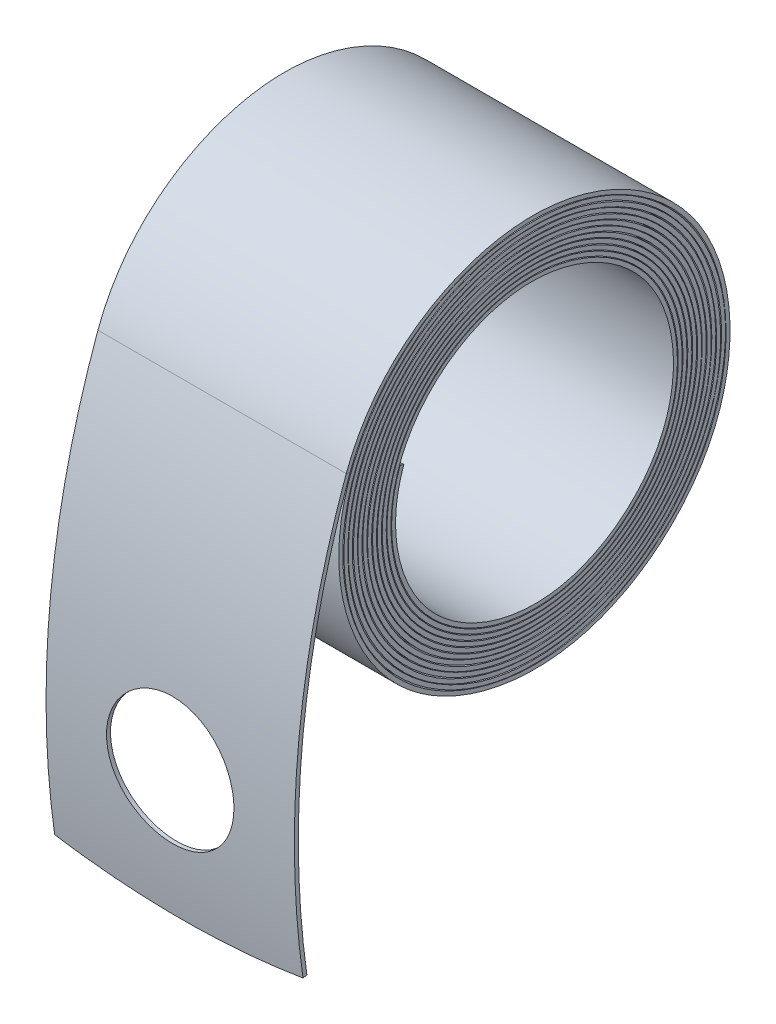
from build123d import *

# Parameters (mm, degrees)
SWEEP1_START            = -2.3749
SWEEP1_DEPTH            = 4.7498
CUT_EXTRUDE1_START      = -4.572
SKETCH7_R               = 1.2192000000000003
CUT_EXTRUDE1_DEPTH      = 0.12166700000000041
CUT_EXTRUDE2_REACH      = 13.155
CUT_EXTRUDE2_END_RADIUS = 16.369069678937333


# Read off the part's stored shape, not the designer's step: Sweep1
with BuildPart() as part:
    # Sweep1 outline → Sweep1 (new body)
    with BuildSketch(Plane.YZ.offset(SWEEP1_START)):
        with BuildLine():
            add(Edge.make_bspline(
                [(1.276898055, 3.508674079), (1.6207778462681415, 3.382007127660769), (1.9457669868007286, 3.204358095663798), (3.18678292573189, 2.265986014946895), (3.75422145730675, 1.07371677352094), (3.6735388158875, -1.29597878619303), (3.02808826352652, -2.44170412489401), (1.05174453831895, -3.73581445451106), (-0.2517671920637865, -3.8668589490294103), (-2.43956389479203, -2.9999255396709197), (-3.29428597823751, -2.01300511932185), (-3.8425929825748453, 0.266013062855288), (-3.52953148950345, 1.5284259136259801), (-1.98722297501447, 3.282250107974825), (-0.779828160464265, 3.75120041098481), (1.53351453670539, 3.50146302129273), (2.60777538466768, 2.78669163071244), (3.73162756099758, 0.759650464713165), (3.765625362695015, -0.5257261918965335), (2.75905914475021, -2.60321417708953), (1.73198544714417, -3.36858710705582), (-0.537781400891161, -3.74000341106201), (-1.74980518307769, -3.3426125811410747), (-3.3546080754273, -1.70727570723673), (-3.72571647682799, -0.4921160790770095), (-3.31479048123764, 1.75277138263188), (-2.53769220955819, 2.75228908871239), (-0.47388907515426504, 3.70462549932604), (0.7858520197412155, 3.64553236135599), (2.745192662344225, 2.51041948113967), (3.41931206548772, 1.45095287773703), (3.61910550041812, -0.795850651038309), (3.14252804355155, -1.95230600688994), (1.42778431871128, -3.40385785468192), (0.2122453784699265, -3.67905223502355), (-1.952808120007775, -3.11478615881886), (-2.87437900138071, -2.2831063024637), (-3.65625551913943, -0.195907189491174), (-3.50752223209037, 1.03110178911378), (-2.256525819320495, 2.86519684412496), (-1.17184312951588, 3.447382431003105), (1.03897574072216, 3.4809425730515153), (2.1354707056295847, 2.93130972054318), (3.4300899859580447, 1.1503079470838), (3.611828041107305, -0.05769922371598165), (2.903468983456325, -2.1334451439962), (2.0243068170648, -2.97385785089863), (-0.0721808703569389, -3.58787571454854), (-1.26058220867215, -3.35352293662327), (-2.96294452981682, -1.998962095872455), (-3.45373545807489, -0.896495094760027), (-3.32657578170129, 1.26603098814232), (-2.7107531910111, 2.29810631459482), (-0.8764944154524714, 3.43445120521951), (0.316564253599465, 3.52477557080314), (2.29392498037441, 2.68320937371314), (3.05126453264996, 1.76332950335773), (3.50027911378631, -0.328992953949677), (3.1854131383814703, -1.4734847666049902), (1.7392502822151301, -3.0382571406932097), (0.6270327069962415, -3.43860327848082), (-1.476493814298685, -3.157923641829615), (-2.43980939258598, -2.48214316040395), (-3.41785848302966, -0.608630866715912), (-3.41959425596945, 0.563138396342894), (-2.45548857325385, 2.43370276026913), (-1.50211823573805, 3.10717219819125), (0.573260556450094, 3.39429953419631), (1.668340686660315, 3.00471819515207), (3.091957716756105, 1.47917960640234), (3.40249959457761, 0.36467997621180603), (2.97712861054816, -1.6691970545567751), (2.24754211882144, -2.56073205261608), (0.3481883520790115, -3.3808406766345), (-0.7963030738472354, -3.29795173027572), (-2.55234735464725, -2.22174725485987), (-3.14143213103142, -1.24276640275922), (-3.27169985849562, 0.804148577151152), (-2.8126039959835403, 1.84455572397366), (-1.221121146804285, 3.12450696749818), (-0.110912973478176, 3.346845974177585), (1.8433608155878, 2.78552827908218), (2.66107791327875, 2.00892916028272), (3.32398883541352, 0.0965343916564848), (3.16106463446891, -1.01437131229279), (1.98385502022341, -2.65034623665456), (0.9865297544781, -3.154339840167355), (-1.02013853260629, -3.1343271589948296), (-2.0020185831695647, -2.61152769373797), (-3.134489760449465, -0.965448846023538), (-3.27287596466396, 0.1333631979129235), (-2.55814608752095, 2.06956192391548), (-1.63542024961609, 2.84561311761919), (0.458315043293819, 3.24370686883354), (1.5927750603682802, 2.8531304617058), (3.00181290549162, 1.26673037638302), (3.25211538015178, 0.09922608167140684), (2.61597968218324, -1.91315752641214), (1.747471961594155, -2.72416849437505), (-0.2937755766731675, -3.21361974851485), (-1.4293078777473749, -2.883918638470485), (-2.894490728905355, -1.3934802119036251), (-3.19395976490287, -0.25569819050230347), (-2.667977782223395, 1.75728679624163), (-1.85241520361399, 2.597241893572095), (0.134700019737362, 3.17464855979853), (1.26887483324066, 2.90826730683807), (2.77949410767114, 1.51082050892951), (3.12909126034985, 0.4056245409043665), (2.71205401144065, -1.600268910251645), (1.94772850450175, -2.46386615990184), (0.0206750154987051, -3.13120714035576), (-1.1079039321065451, -2.92381955861822), (-2.66029894360071, -1.6187663839698598), (-3.060637818133615, -0.5494726169589825), (-2.744236738838985, 1.44218343674698), (-2.03396814457547, 2.32864638325915), (-0.172589113260102, 3.08068199010451), (0.9470182796280875, 2.927970101070905), (2.539521960249445, 1.7211869810710398), (2.98474382057348, 0.6889105662532831), (2.7664306923024, -1.28590635283188), (2.1132270579199, -2.19388000230336), (0.3188195919299255, -3.01988356781702), (-0.7896696253832995, -2.9236895574773447), (-2.41490215361793, -1.816861087029025), (-2.8996276334866, -0.821966783054405), (-2.78322490365266, 1.13143000732143), (-2.18480569671214, 2.05550386375984), (-0.458016497437425, 2.95195782607403), (0.636587809871466, 2.91394237892685), (2.28505158776698, 1.90224824884599), (2.809597174177845, 0.947450350068445), (2.792399151971675, -0.977572916536472), (2.2460911830819352, -1.91316726671638), (0.5927183667195666, -2.88062935765657), (-0.4848100072623935, -2.8959742854326347), (-2.15331580883726, -1.977940011386), (-2.7174696126864752, -1.06638708194566), (-2.79032102406424, 0.825128061423298), (-2.29846622213315, 1.77103148504932), (-0.7226859646830226, 2.80344950957273), (0.335516564066088, 2.86745105165632), (2.02131884603029, 2.04805371786421), (2.61939421171567, 1.17973497986579), (2.77930170748669, -0.676550493083939), (2.34430745602026, -1.63083274610888), (0.8453043047062574, -2.71789607164799), (-0.191342216634435, -2.8317715386465654), (-1.88719575183536, -2.111069821480255), (-2.51412472644904, -1.28521732837661), (-2.76358009588812, 0.530885891715558), (-2.382340074041455, 1.48889435499151), (-0.9597926027607504, 2.62722304874707), (0.0443495350690404, 2.7948021468393103), (0.901359187, 2.477659233)],
                knots=[5.1701112334e-07, 5.1701112334e-07, 5.1701112334e-07, 5.1701112334e-07, 0.00390625000000151, 0.00390625000000151, 0.0166015625000064, 0.0166015625000064, 0.02929687500001129, 0.02929687500001129, 0.04199218750001619, 0.04199218750001619, 0.05468750000002108, 0.05468750000002108, 0.06738281250002608, 0.06738281250002608, 0.08007812500003096, 0.08007812500003096, 0.09277343750003586, 0.09277343750003586, 0.10546875000004066, 0.10546875000004066, 0.11816406250004555, 0.11816406250004555, 0.13085937500005043, 0.13085937500005043, 0.14355468750005534, 0.14355468750005534, 0.15625000000006023, 0.15625000000006023, 0.16894531250006511, 0.16894531250006511, 0.18164062500007003, 0.18164062500007003, 0.1943359375000749, 0.1943359375000749, 0.2070312500000798, 0.2070312500000798, 0.2197265625000847, 0.2197265625000847, 0.2324218750000896, 0.2324218750000896, 0.24511718750009448, 0.24511718750009448, 0.25781250000009936, 0.25781250000009936, 0.27050781250010425, 0.27050781250010425, 0.2832031250001092, 0.2832031250001092, 0.2958984375001141, 0.2958984375001141, 0.30859375000011896, 0.30859375000011896, 0.32128906250012385, 0.32128906250012385, 0.33398437500012873, 0.33398437500012873, 0.3466796875001336, 0.3466796875001336, 0.35937500000013856, 0.35937500000013856, 0.37207031250014344, 0.37207031250014344, 0.3847656250001483, 0.3847656250001483, 0.3974609375001532, 0.3974609375001532, 0.4101562500001581, 0.4101562500001581, 0.422851562500163, 0.422851562500163, 0.43554687500016787, 0.43554687500016787, 0.4482421875001728, 0.4482421875001728, 0.4609375000001777, 0.4609375000001777, 0.4736328125001826, 0.4736328125001826, 0.48632812500018746, 0.48632812500018746, 0.49902343750019235, 0.49902343750019235, 0.5117187500001973, 0.5117187500001973, 0.5244140625002022, 0.5244140625002022, 0.5371093750002071, 0.5371093750002071, 0.5498046875002119, 0.5498046875002119, 0.5625000000002168, 0.5625000000002168, 0.576171875000222, 0.576171875000222, 0.5898437500002274, 0.5898437500002274, 0.6035156250002326, 0.6035156250002326, 0.6171875000002379, 0.6171875000002379, 0.6308593750002431, 0.6308593750002431, 0.6445312500002485, 0.6445312500002485, 0.6582031250002537, 0.6582031250002537, 0.671875000000259, 0.671875000000259, 0.6855468750002642, 0.6855468750002642, 0.6992187500002696, 0.6992187500002696, 0.7128906250002748, 0.7128906250002748, 0.7265625000002801, 0.7265625000002801, 0.7402343750002853, 0.7402343750002853, 0.7539062500002907, 0.7539062500002907, 0.7675781250002959, 0.7675781250002959, 0.7812500000003011, 0.7812500000003011, 0.7949218750003064, 0.7949218750003064, 0.8085937500003116, 0.8085937500003116, 0.822265625000317, 0.822265625000317, 0.8359375000003222, 0.8359375000003222, 0.8496093750003275, 0.8496093750003275, 0.8632812500003327, 0.8632812500003327, 0.8769531250003381, 0.8769531250003381, 0.8906250000003433, 0.8906250000003433, 0.9042968750003486, 0.9042968750003486, 0.9179687500003538, 0.9179687500003538, 0.9316406250003592, 0.9316406250003592, 0.9453125000003644, 0.9453125000003644, 0.9589843750003697, 0.9589843750003697, 0.9726562500003749, 0.9726562500003749, 0.9863281250003803, 0.9863281250003803, 1.0000000000003855, 1.0000000000003855, 1.0000000000003855, 1.0000000000003855], degree=3))
            Line((0.901359187, 2.477659233), (0.927804883, 2.549122966))
            add(Edge.make_bspline(
                [(1.303096746, 3.580228885), (1.65409620240162, 3.45095508558113), (1.98567666238742, 3.26971219876617), (3.25227316447132, 2.31199783279412), (3.83120392654069, 1.0954015049437), (3.74886808893214, -1.32284937955597), (3.09009853662135, -2.49218232114899), (1.07322026296345, -3.81283468248739), (-0.25725532369999, -3.94664868886222), (-2.49021844243242, -3.06181769551869), (-3.36264408243786, -2.05463718043056), (-3.92240687103053, 0.271996553272543), (-3.60279456261327, 1.5605047358059), (-2.02840283449015, 3.35081210843279), (-0.795735213028206, 3.82956040375486), (1.56577892208427, 3.57462265650263), (2.66263921889309, 2.84488512134441), (3.8100489411455, 0.775354278696821), (3.84487733887617, -0.536914730813621), (2.81695699220992, -2.65847626552298), (1.76826378790952, -3.43986411104766), (-0.549448889784547, -3.81912609447056), (-1.7872241092326, -3.413274786733), (-3.42596291575984, -1.743356312757), (-3.80504496497029, -0.502290268785167), (-3.38537116829808, 1.79038640304962), (-2.59185333089602, 2.8112181332651), (-0.483582021617319, 3.78407426377925), (0.803030872761775, 3.72364392858732), (2.80440993100094, 2.56417676008768), (3.49306680582596, 1.48183267991052), (3.6971517682563, -0.81323178969941), (3.21030161922877, -1.99477088816058), (1.45847664444308, -3.47771247418269), (0.216723335257802, -3.75896473405012), (-1.99572134108026, -3.18234735391898), (-2.93721498494998, -2.33258528530911), (-3.7361345980728, -0.199890070949856), (-3.58412391538761, 1.05402572025375), (-2.30582593885551, 2.92814779897379), (-1.19728856081001, 3.52320494934774), (1.06210801248201, 3.5575024988826), (2.18270929393094, 2.99592067651396), (3.50612433016174, 1.17530471461723), (3.69178994757959, -0.0593193367794181), (2.96773997697507, -2.18104525604579), (2.06897362049709, -3.04017679088283), (-0.0740122487846921, -3.66781300986622), (-1.28901882258656, -3.42827508601886), (-3.02939805392918, -2.04346438750637), (-3.53124146040769, -0.916467068520148), (-3.40120699066838, 1.29494885134359), (-2.77153333408218, 2.35009002523511), (-0.895974183229724, 3.51202098434548), (0.324113982075053, 3.60437662222188), (2.34605643086794, 2.74383641105287), (3.12067128726636, 1.80306900363163), (3.57987981381594, -0.336755298941851), (3.25799387152984, -1.50722046886363), (1.77859091774134, -3.10795918412738), (0.641032862458197, -3.5173467122104), (-1.51065049819841, -3.23024136909563), (-2.49614772146553, -2.53888220495352), (-3.49661898971085, -0.622418871091778), (-3.49845594798021, 0.57645604070857), (-2.51209240146584, 2.49020526221367), (-1.53681710855062, 3.17929742939441), (0.58707391916091, 3.47313640243467), (1.70747768360184, 3.07446652101217), (3.1642415205387, 1.5134080335498), (3.48204516663063, 0.372793493899967), (3.04675549610258, -1.70850893584553), (2.30005005049148, -2.62105985643652), (0.356093117870638, -3.46042736807958), (-0.815241918844897, -3.37571664038026), (-2.61304262517963, -2.27392143680906), (-3.21593544939623, -1.27184886935156), (-3.34928885094311, 0.82355173634173), (-2.87923744551055, 1.88875200627282), (-1.2499987133112, 3.19906844627663), (-0.113224626014256, 3.42679085384421), (1.887744609489, 2.8520610254236), (2.72505500618043, 2.05702274660858), (3.40400600486977, 0.0983548555368954), (3.23710432178273, -1.03916044551517), (2.0315179851077, -2.71457066329332), (1.00999442543549, -3.23077764484644), (-1.04512302675016, -3.21028177583822), (-2.05117498454247, -2.67451691709859), (-3.21088914064721, -0.988839630269896), (-3.35301550402215, 0.136306259990585), (-2.62031090000745, 2.12119841051758), (-1.67528783089728, 2.91559801504173), (0.469715938387208, 3.3234397318053), (1.63260842741866, 2.92302909516494), (3.0759237836085, 1.29803682675499), (3.33263690114118, 0.101139903873732), (2.68077075530717, -1.96100619368937), (1.79141149966819, -2.79199258599176), (-0.302179845433301, -3.29399486281635), (-1.46535528871224, -2.95594567868415), (-2.96712325141903, -1.4282915171428), (-3.27420910079766, -0.261404436892524), (-2.73517800188794, 1.80152080619728), (-1.89873596670525, 2.66313397775463), (0.138495996632909, 3.25510333263386), (1.30086373624774, 2.98247984338932), (2.85099615236047, 1.54848014829747), (3.20900734484078, 0.415660989166354), (2.78134726219678, -1.6413268716155), (1.99705136050803, -2.52742537770881), (0.0212227616815854, -3.21165723834916), (-1.13696374402001, -2.99893885754018), (-2.72930747871083, -1.66030195769392), (-3.14011674969701, -0.564097597349291), (-2.81527035704915, 1.48071934268733), (-2.0867063594474, 2.38952324327206), (-0.176940268894263, 3.16110822197291), (0.972470850424316, 3.00428973245891), (2.60611382219063, 1.76633167531837), (3.06334971151477, 0.706474667063905), (2.83930201213205, -1.32021603864435), (2.1695377259827, -2.25184464175356), (0.326234418727092, -3.10035599459134), (-0.810994787778543, -3.00135904587964), (-2.47936154294358, -1.86515496904069), (-2.97722790647132, -0.843196912711392), (-2.85775476625195, 1.16172555738734), (-2.24307521943243, 2.11111005539563), (-0.46996608281666, 3.0316107814772), (0.653507191280397, 2.99296468897148), (2.34784771220835, 1.95311511512884), (2.8860272420749, 0.972862106023521), (2.86836300253174, -1.00434614863348), (2.30685031306404, -1.9659010344068), (0.608926865364294, -2.95943168441767), (-0.498680376908069, -2.97531532707117), (-2.21291173383759, -2.032122239446), (-2.79257734566668, -1.09621357399633), (-2.86750038225868, 0.849089243459549), (-2.36205228779835, 1.82046958341855), (-0.742619682240735, 2.88148770629555), (0.345615785230673, 2.94726664730967), (2.07784188190495, 2.10530465666401), (2.69307341427202, 1.21227365679848), (2.85746017119354, -0.696009296020802), (2.41082980139431, -1.67671922585556), (0.868251244671805, -2.79538303710254), (-0.197130974426574, -2.91210711209767), (-1.94101430282645, -2.17099375301765), (-2.58610387346759, -1.32115515684104), (-2.84258330632883, 0.546085163430689), (-2.45032404828122, 1.53208662413687), (-0.987026980523051, 2.7030233232421), (0.0459717834009221, 2.87545198415087), (0.927804883, 2.549122966)],
                knots=[0, 0, 0, 0, 0.00390625, 0.00390625, 0.0166015625, 0.0166015625, 0.029296875, 0.029296875, 0.0419921875, 0.0419921875, 0.0546875, 0.0546875, 0.0673828125000001, 0.0673828125000001, 0.0800781250000001, 0.0800781250000001, 0.0927734375000001, 0.0927734375000001, 0.10546875, 0.10546875, 0.1181640625, 0.1181640625, 0.130859375, 0.130859375, 0.1435546875, 0.1435546875, 0.15625, 0.15625, 0.1689453125, 0.1689453125, 0.181640625, 0.181640625, 0.1943359375, 0.1943359375, 0.20703125, 0.20703125, 0.2197265625, 0.2197265625, 0.232421875, 0.232421875, 0.2451171875, 0.2451171875, 0.2578125, 0.2578125, 0.2705078125, 0.2705078125, 0.283203125, 0.283203125, 0.2958984375, 0.2958984375, 0.30859375, 0.30859375, 0.3212890625, 0.3212890625, 0.333984375, 0.333984375, 0.3466796875, 0.3466796875, 0.359375, 0.359375, 0.3720703125, 0.3720703125, 0.384765625, 0.384765625, 0.3974609375, 0.3974609375, 0.41015625, 0.41015625, 0.4228515625, 0.4228515625, 0.435546875, 0.435546875, 0.4482421875, 0.4482421875, 0.4609375, 0.4609375, 0.4736328125, 0.4736328125, 0.486328125, 0.486328125, 0.4990234375, 0.4990234375, 0.51171875, 0.51171875, 0.5244140625, 0.5244140625, 0.537109375, 0.537109375, 0.5498046875, 0.5498046875, 0.5625, 0.5625, 0.576171875, 0.576171875, 0.58984375, 0.58984375, 0.603515625, 0.603515625, 0.6171875, 0.6171875, 0.630859375, 0.630859375, 0.64453125, 0.64453125, 0.658203125, 0.658203125, 0.671875, 0.671875, 0.685546875, 0.685546875, 0.69921875, 0.69921875, 0.712890625, 0.712890625, 0.7265625, 0.7265625, 0.740234375, 0.740234375, 0.75390625, 0.75390625, 0.767578125, 0.767578125, 0.78125, 0.78125, 0.794921875, 0.794921875, 0.80859375, 0.80859375, 0.822265625, 0.822265625, 0.8359375, 0.8359375, 0.849609375, 0.849609375, 0.86328125, 0.86328125, 0.876953125, 0.876953125, 0.890625, 0.890625, 0.904296875, 0.904296875, 0.91796875, 0.91796875, 0.931640625, 0.931640625, 0.9453125, 0.9453125, 0.958984375, 0.958984375, 0.97265625, 0.97265625, 0.986328125, 0.986328125, 1, 1, 1, 1], degree=3))
            ThreePointArc((1.303096746, 3.580228885), (-2.728880182, 4.49469915), (-6.861516747, 4.374662338))
            Line((-6.861516747, 4.374662338), (-6.849747526, 4.299376712))
            ThreePointArc((-6.849747526, 4.299376712), (-2.736332169, 4.418864374), (1.276898055, 3.508674079))
        make_face()
    extrude(amount=SWEEP1_DEPTH)

    # Sketch7 → Cut-Extrude1 (cut)
    with BuildSketch(Plane(origin=(0, -4.26800245264398, 0), x_dir=(1, 0, 0), z_dir=(0, 0, -1)).offset(CUT_EXTRUDE1_START)):
        with Locations((0, 0.05351429390470629)):
            Circle(SKETCH7_R)
    extrude(amount=CUT_EXTRUDE1_DEPTH, mode=Mode.SUBTRACT)

    # Cut-Extrude2: up to this cylinder (the profile starts outside it)
    cut_extrude2_end = Plane(origin=(0, -4.321516746548683, -11.873269678937326), z_dir=(-1, 0, 0)) * Cylinder(CUT_EXTRUDE2_END_RADIUS, 60.04813935787466, mode=Mode.PRIVATE)
    # Sketch8 → Cut-Extrude2 (cut, up to the surface)
    with BuildSketch(Plane(origin=(0, -0.8312499608755256, 5.317359390956003), x_dir=(1, 0, 0), z_dir=(0, -0.15445170858177842, 0.9880003389251288)), mode=Mode.PRIVATE) as cut_extrude2_sk1:
        with BuildLine():
            Line((2.3749000000000002, -6.103506798624813), (2.3749000000000002, -5.879477702326055))
            ThreePointArc((2.3749000000000002, -5.879477702326055), (7.8e-16, -6.103506798624813), (-2.3748999999999976, -5.879477702326055))
            Line((-2.3748999999999976, -5.879477702326055), (-2.3749000000000002, -6.103506798624813))
            Line((-2.3749000000000002, -6.103506798624813), (-2.374899999999998, -6.357506798624812))
            Line((-2.374899999999998, -6.357506798624812), (2.3749, -6.357506798624812))
            Line((2.3749, -6.357506798624812), (2.3749000000000002, -6.103506798624813))
        make_face()
    cut_extrude2_tool1 = extrude(cut_extrude2_sk1.sketch, amount=-CUT_EXTRUDE2_REACH, mode=Mode.PRIVATE) - cut_extrude2_end
    add(cut_extrude2_tool1.solids().sort_by_distance((0, -6.94354, 4.36184))[0], mode=Mode.SUBTRACT)


solid = part.part
